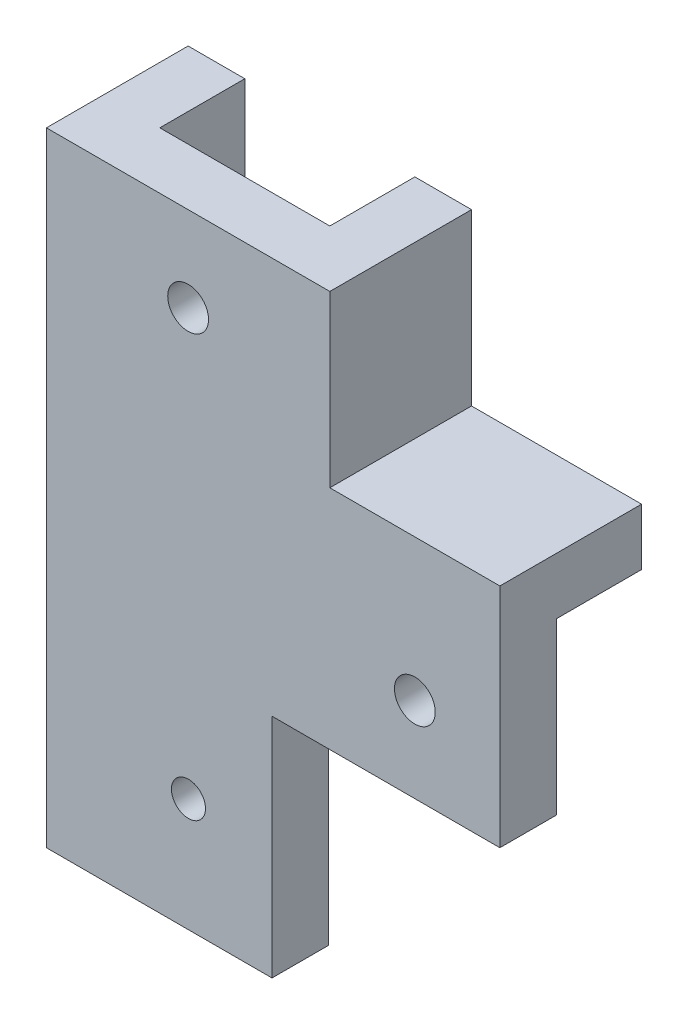
from build123d import *

# Parameters (mm, degrees)
BOSS_EXTRUDE1_DEPTH = 5
BOSS_EXTRUDE2_DEPTH = 7.5
BOSS_EXTRUDE3_DEPTH = 7.5
SKETCH4_R           = 1.8
CUT_EXTRUDE1_DEPTH  = 54.936239309
SKETCH6_W           = 14.9
SKETCH6_H           = 20
BOSS_EXTRUDE4_DEPTH = 5
SKETCH8_R           = 1.5
CUT_EXTRUDE3_DEPTH  = 55.85542736
SKETCH9_W           = 5
SKETCH9_H           = 55
BOSS_EXTRUDE5_DEPTH = 5
BOSS_EXTRUDE6_DEPTH = 5


with BuildPart() as part:
    # Sketch1 → Boss-Extrude1 (new body)
    with BuildSketch(Plane.XY):
        Polygon((7.370119522, -25.806772908), (27.470119522, -25.806772908), (27.470119522, -10.806772908), (7.470119522, -10.806772908), (7.470119522, 9.193227092), (-7.529880478, 9.193227092), (-7.529880478, -25.806772908), align=None)
    extrude(amount=BOSS_EXTRUDE1_DEPTH)

    # Sketch4 → Cut-Extrude1 (cut, through all)
    with BuildSketch(Plane(origin=(0, 0, 0), x_dir=(-1, 0, 0), z_dir=(0, 0, -1))):
        with Locations((0.029880478, 1.693227092)):
            Circle(SKETCH4_R)
        with Locations((-19.970119522, -18.306772908)):
            Circle(SKETCH4_R)
    extrude(amount=-CUT_EXTRUDE1_DEPTH, mode=Mode.SUBTRACT)

    # Sketch6 → Boss-Extrude4 (add)
    with BuildSketch(Plane.XY.offset(5)):
        with Locations((-0.079880478, -35.806772908)):
            Rectangle(SKETCH6_W, SKETCH6_H)
    extrude(amount=-BOSS_EXTRUDE4_DEPTH)

    # Sketch8 → Cut-Extrude3 (cut, through all)
    with BuildSketch(Plane.XY.offset(5)):
        with Locations((0, -35.806772908)):
            Circle(SKETCH8_R)
    extrude(amount=-CUT_EXTRUDE3_DEPTH, mode=Mode.SUBTRACT)



with BuildPart() as body_2:
    # Sketch2 → Boss-Extrude2 (new body)
    with BuildSketch(Plane(origin=(0, 0, 0), x_dir=(-1, 0, 0), z_dir=(0, 0, -1))):
        Polygon((-7.470119522, 9.193227092), (-12.470119522, 9.193227092), (-12.470119522, -5.806772908), (-27.470119522, -5.806772908), (-27.470119522, -10.806772908), (-7.470119522, -10.806772908), align=None)
    extrude(amount=BOSS_EXTRUDE2_DEPTH)


with BuildPart() as body_3:
    # Sketch3 → Boss-Extrude3 (new body)
    with BuildSketch(Plane(origin=(0, 0, 0), x_dir=(-1, 0, 0), z_dir=(0, 0, -1))):
        Polygon((7.529880478, 9.193227092), (12.529880478, 9.193227092), (12.529880478, -45.806772908), (7.529880478, -45.806772908), (7.529880478, -25.806772908), align=None)
    extrude(amount=BOSS_EXTRUDE3_DEPTH)


with BuildPart() as part_1:
    add(part.part)

    add(body_3.part)  # Boss-Extrude5 merges body 3
    # Sketch9 → Boss-Extrude5 (add)
    with BuildSketch(Plane.XY.offset(5)):
        with Locations((-10.029880478, -18.306772908)):
            Rectangle(SKETCH9_W, SKETCH9_H)
    extrude(amount=-BOSS_EXTRUDE5_DEPTH)


    add(body_2.part)  # Boss-Extrude6 merges body 2
    # Sketch10 → Boss-Extrude6 (add)
    with BuildSketch(Plane.XY):
        Polygon((7.470119522, 9.193227092), (12.470119522, 9.193227092), (12.470119522, -5.806772908), (27.470119522, -5.806772908), (27.470119522, -10.806772908), (7.470119522, -10.806772908), align=None)
    extrude(amount=BOSS_EXTRUDE6_DEPTH)


solid = part_1.part
